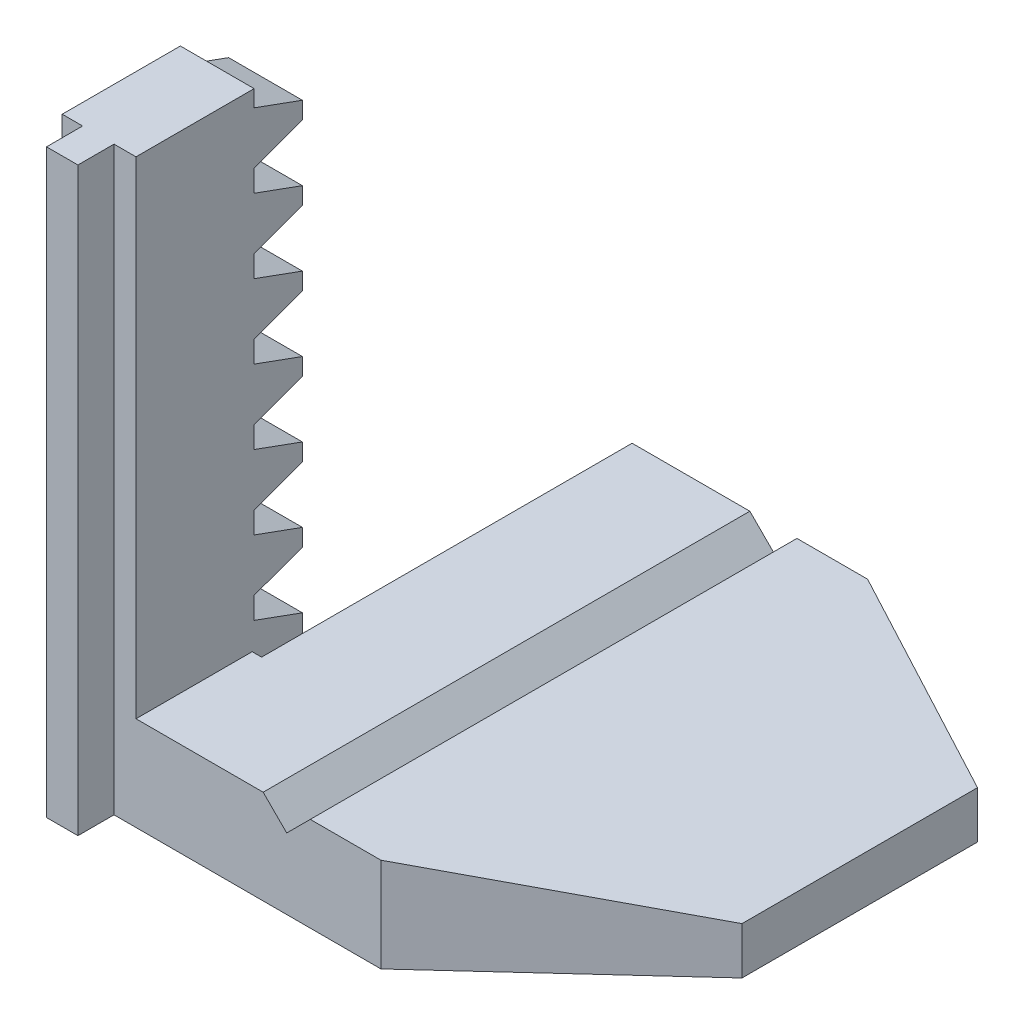
from build123d import *

# Parameters (mm, degrees)
BOSS_EXTRUDE1_DEPTH = 4.7
SKETCH2_W           = 2.4
SKETCH2_H           = 37
BOSS_EXTRUDE2_DEPTH = 2
SKETCH3_W           = 7.4
SKETCH3_H           = 6
BOSS_EXTRUDE3_DEPTH = 0.8
SKETCH4_W           = 31
SKETCH4_H           = 6
BOSS_EXTRUDE4_DEPTH = 30
CUT_EXTRUDE1_DEPTH  = 6.5
CUT_EXTRUDE2_DEPTH  = 405.447882922
CUT_EXTRUDE3_DEPTH  = 405.447882922
CUT_EXTRUDE4_DEPTH  = 4.7


with BuildPart() as part:
    # Sketch1 → Boss-Extrude1 (new body)
    with BuildSketch(Plane(origin=(209.7, 0, 0), x_dir=(0, 0, -1), z_dir=(1, 0, 0))):
        Polygon((-318, -6), (-318, 31), (-310.475, 31), (-310.475, 30.0599), (-307.4, 28.9407), (-307.4, 27.608), (-310.475, 26.4888), (-310.475, 25.3475), (-307.4, 24.2283), (-307.4, 22.8956), (-310.475, 21.7764), (-310.475, 20.6351), (-307.4, 19.5159), (-307.4, 18.1832), (-310.475, 17.064), (-310.475, 15.9227), (-307.4, 14.8035), (-307.4, 13.4708), (-310.475, 12.3516), (-310.475, 11.2103), (-307.4, 10.0911), (-307.4, 8.7584), (-310.475, 7.6392), (-310.475, 6.4979), (-307.4, 5.3787), (-307.4, 4.0461), (-310.475, 2.9268), (-310.475, 1.7855), (-307.4, 0.6663), (-307.4, -0.6663), (-310.475, -1.7855), (-310.475, -2.9268), (-307.4, -4.0461), (-307.4, -5.3787), (-309.1069, -6), align=None)
    extrude(amount=BOSS_EXTRUDE1_DEPTH)

    # Sketch2 → Boss-Extrude2 (add)
    with BuildSketch(Plane(origin=(211, 0, 0), x_dir=(0, 0, -1), z_dir=(1, 0, 0))):
        with Locations((-319.1, 12.5)):
            Rectangle(SKETCH2_W, SKETCH2_H)
    extrude(amount=BOSS_EXTRUDE2_DEPTH)

    # Sketch3 → Boss-Extrude3 (add)
    with BuildSketch(Plane(origin=(214.4, 0, 0), x_dir=(0, 0, -1), z_dir=(1, 0, 0))):
        with Locations((-314.3, -3)):
            Rectangle(SKETCH3_W, SKETCH3_H)
    extrude(amount=BOSS_EXTRUDE3_DEPTH)

    # Sketch4 → Boss-Extrude4 (add)
    with BuildSketch(Plane(origin=(215, 0, 0), x_dir=(0, 0, -1), z_dir=(1, 0, 0))):
        with Locations((-302.5, -3)):
            Rectangle(SKETCH4_W, SKETCH4_H)
    extrude(amount=BOSS_EXTRUDE4_DEPTH)

    # Sketch5 → Cut-Extrude1 (cut, symmetric)
    with BuildSketch(Plane(origin=(0, 0, 0), x_dir=(1, 0, 0), z_dir=(0, 1, 0))):
        Polygon((228.125, -319), (246.5, -309.2), (246.5, -319), align=None)
        Polygon((228.125, -286), (246.5, -295.8), (246.5, -286), align=None)
    extrude(amount=CUT_EXTRUDE1_DEPTH, both=True, mode=Mode.SUBTRACT)

    # Sketch6 → Cut-Extrude2 (cut, through all)
    with BuildSketch(Plane.XY):
        Polygon((227.5, -6.5), (246.5, -2.7), (246.5, -6.5), align=None)
    extrude(amount=CUT_EXTRUDE2_DEPTH, mode=Mode.SUBTRACT)

    # Sketch7 → Cut-Extrude3 (cut, through all)
    with BuildSketch(Plane.XY):
        Polygon((222, 0.5), (226, 0.5), (224, -1.5), align=None)
    extrude(amount=CUT_EXTRUDE3_DEPTH, mode=Mode.SUBTRACT)

    # Sketch8 → Cut-Extrude4 (cut, symmetric)
    with BuildSketch(Plane(origin=(209.7, 0, 0), x_dir=(0, 0, -1), z_dir=(1, 0, 0))):
        Polygon((-307, -4.1716), (-310.475, -2.907), (-310.475, -3.047), (-307, -4.3116), align=None)
        Polygon((-307, -5.2532), (-310.475, -6.5178), (-310.475, -6.3778), (-307, -5.1132), align=None)
        Polygon((-307, 0.5408), (-310.475, 1.8054), (-310.475, 1.6654), (-307, 0.4008), align=None)
        Polygon((-307, -0.5408), (-310.475, -1.8054), (-310.475, -1.6654), (-307, -0.4008), align=None)
        Polygon((-307, 5.2532), (-310.475, 6.5178), (-310.475, 6.3778), (-307, 5.1132), align=None)
        Polygon((-307, 4.1716), (-310.475, 2.907), (-310.475, 3.047), (-307, 4.3116), align=None)
        Polygon((-307, 9.9656), (-310.475, 11.2302), (-310.475, 11.0902), (-307, 9.8256), align=None)
        Polygon((-307, 8.884), (-310.475, 7.6194), (-310.475, 7.7594), (-307, 9.024), align=None)
        Polygon((-307, 14.678), (-310.475, 15.9426), (-310.475, 15.8026), (-307, 14.538), align=None)
        Polygon((-307, 13.5964), (-310.475, 12.3318), (-310.475, 12.4718), (-307, 13.7364), align=None)
        Polygon((-307, 19.3904), (-310.475, 20.655), (-310.475, 20.515), (-307, 19.2504), align=None)
        Polygon((-307, 18.3088), (-310.475, 17.0442), (-310.475, 17.1842), (-307, 18.4488), align=None)
        Polygon((-307, 24.1027), (-310.475, 25.3673), (-310.475, 25.2274), (-307, 23.9628), align=None)
        Polygon((-307, 23.0211), (-310.475, 21.7565), (-310.475, 21.8965), (-307, 23.1611), align=None)
        Polygon((-307, 28.8151), (-310.475, 30.0797), (-310.475, 29.9397), (-307, 28.6751), align=None)
        Polygon((-307, 27.7335), (-310.475, 26.4689), (-310.475, 26.6089), (-307, 27.8735), align=None)
    extrude(amount=CUT_EXTRUDE4_DEPTH, both=True, mode=Mode.SUBTRACT)


solid = part.part
